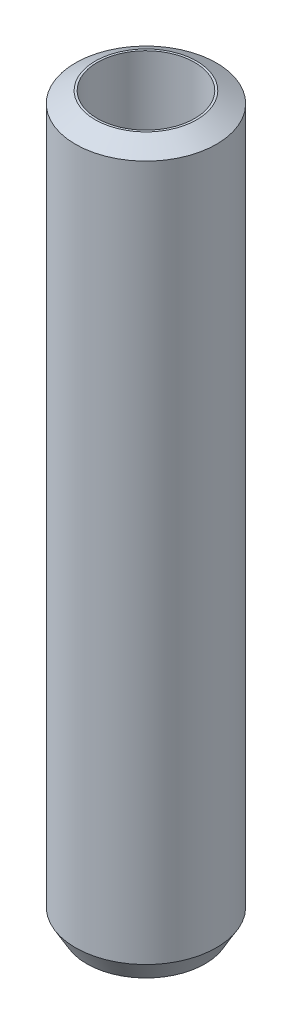
from build123d import *
from OCP.BRepFilletAPI import BRepFilletAPI_MakeChamfer

# Parameters (mm, degrees)
SKETCH1_R           = 35
BOSS_EXTRUDE1_DEPTH = 360.724396873
SKETCH2_R           = 24.159978087
CUT_EXTRUDE1_DEPTH  = 365.104504915
CHAMFER1_SIZE       = 5.647006973
CHAMFER1_SIZE2      = 9.780902988


with BuildPart() as part:
    # Sketch1 → Boss-Extrude1 (new body)
    with BuildSketch(Plane(origin=(0, 0, 0), x_dir=(1, 0, 0), z_dir=(0, 1, 0))):
        Circle(SKETCH1_R)
    extrude(amount=BOSS_EXTRUDE1_DEPTH)

    # Sketch2 → Cut-Extrude1 (cut, through all)
    with BuildSketch(Plane(origin=(0, 0, 0), x_dir=(1, 0, 0), z_dir=(0, 1, 0))):
        Circle(SKETCH2_R)
    extrude(amount=CUT_EXTRUDE1_DEPTH, mode=Mode.SUBTRACT)

    # Chamfer1: one chamfer whose edges measure the first distance from different faces: ONE call of the kernel's chamfer builder (chamfer() names one face for all edges)
    chamfer1_edges_1 = [part.edges().sort_by_distance(p)[0] for p in [
        (-35, 360.724396873, 0),
    ]]
    chamfer1_side_1 = [part.faces().sort_by_distance(p)[0] for p in [
        (-35, 180.362198436, 0),
    ]]
    chamfer1_edges_2 = [part.edges().sort_by_distance(p)[0] for p in [
        (-35, 0, 0),
    ]]
    chamfer1_side_2 = [part.faces().sort_by_distance(p)[0] for p in [
        (-34.010050506, 0, 0),
    ]]
    chamfer1 = BRepFilletAPI_MakeChamfer(part.part.solid().wrapped)
    for e in chamfer1_edges_1:
        chamfer1.Add(CHAMFER1_SIZE, CHAMFER1_SIZE2, e.wrapped, chamfer1_side_1[0].wrapped)  # the first distance lies on this face
    for e in chamfer1_edges_2:
        chamfer1.Add(CHAMFER1_SIZE, CHAMFER1_SIZE2, e.wrapped, chamfer1_side_2[0].wrapped)  # the first distance lies on this face
    add(Compound.cast(chamfer1.Shape()), mode=Mode.REPLACE)


solid = part.part
